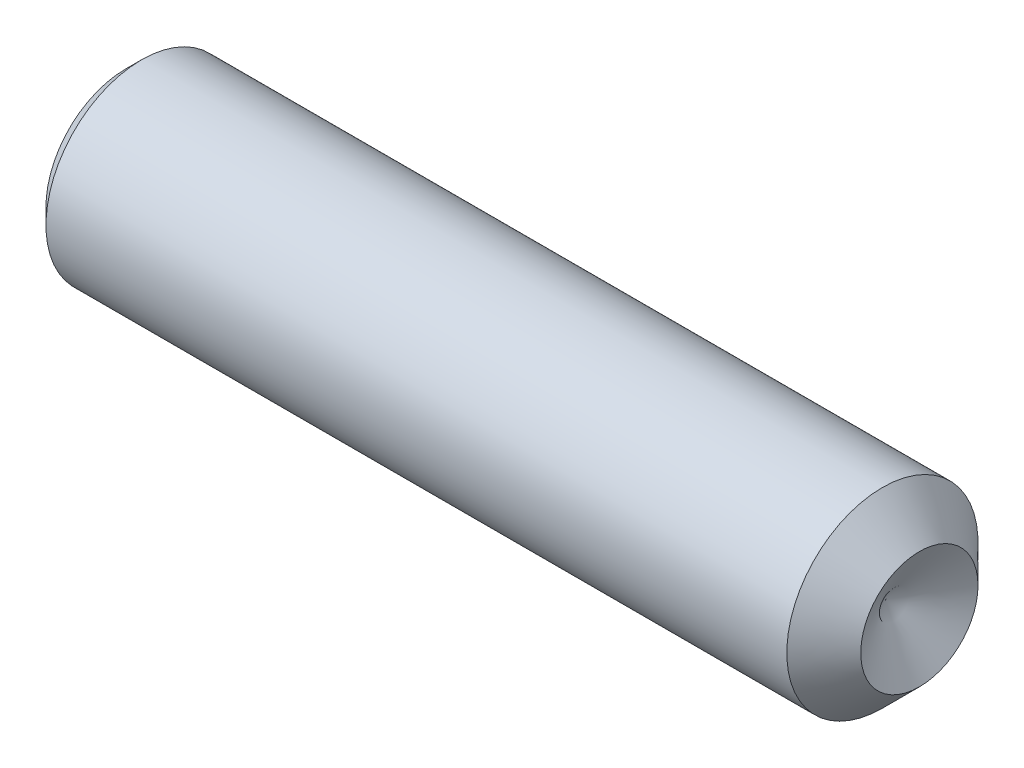
from build123d import *

# Parameters (mm, degrees)
SKETCH1_W          = 25
SKETCH1_H          = 3
CUT_EXTRUDE1_DEPTH = 2
CHAMFER1_SIZE      = 0.5
CHAMFER2_SIZE      = 1.25


with BuildPart() as part:
    # Sketch1 → Revolve1 (revolve)
    with BuildSketch(Plane.XY, mode=Mode.PRIVATE) as revolve1_sk:
        with Locations((12.5, 1.5)):
            Rectangle(SKETCH1_W, SKETCH1_H)
    revolve(revolve1_sk.sketch.rotate(Axis((25, 0, 0), (-1, 0, 0)), 180), axis=Axis((25, 0, 0), (-1, 0, 0)))

    # Sketch2 → Cut-Revolve1 (revolve, cut)
    with BuildSketch(Plane.XY, mode=Mode.PRIVATE) as cut_revolve1_sk:
        Polygon((2, 1.495), (2.863138652, 0), (0, 0), (0, 1.495), align=None)
    revolve(cut_revolve1_sk.sketch.rotate(Axis((-1.178327448, 0, 0), (1, 0, 0)), 270), axis=Axis((-1.178327448, 0, 0), (1, 0, 0)), mode=Mode.SUBTRACT)

    # Sketch3 → Cut-Extrude1 (cut)
    with BuildSketch(Plane.ZY):
        Polygon((0, 1.732050808), (-1.5, 0.866025404), (-1.5, -0.866025404), (0, -1.732050808), (1.5, -0.866025404), (1.5, 0.866025404), align=None)
    extrude(amount=-CUT_EXTRUDE1_DEPTH, mode=Mode.SUBTRACT)

    # Sketch4 → Cut-Revolve2 (revolve, cut)
    with BuildSketch(Plane.XY, mode=Mode.PRIVATE) as cut_revolve2_sk:
        Polygon((25, 1.995), (25, 0), (23.848186213, 0), align=None)
    revolve(cut_revolve2_sk.sketch.rotate(Axis((-1.256465595, 0, 0), (1, 0, 0)), 90), axis=Axis((-1.256465595, 0, 0), (1, 0, 0)), mode=Mode.SUBTRACT)

    # Chamfer1
    chamfer1_edges = [part.edges().sort_by_distance(p)[0] for p in [
        (0, 3, 0),
    ]]
    chamfer(chamfer1_edges, length=CHAMFER1_SIZE)

    # Chamfer2
    # the kernel refuses this chamfer: 1.25 mm, written as the material it takes off along each edge
    with BuildSketch(Plane(origin=(25, 0, 0), x_dir=(0, -1, 0), z_dir=(0, 0, -1))) as chamfer2_piece_1:
        Polygon((3, CHAMFER2_SIZE), (3 - CHAMFER2_SIZE, 0), (3, 0), align=None)
    revolve(axis=Axis((25, 0, 0), (-1, 0, 0)), mode=Mode.SUBTRACT)


solid = part.part
